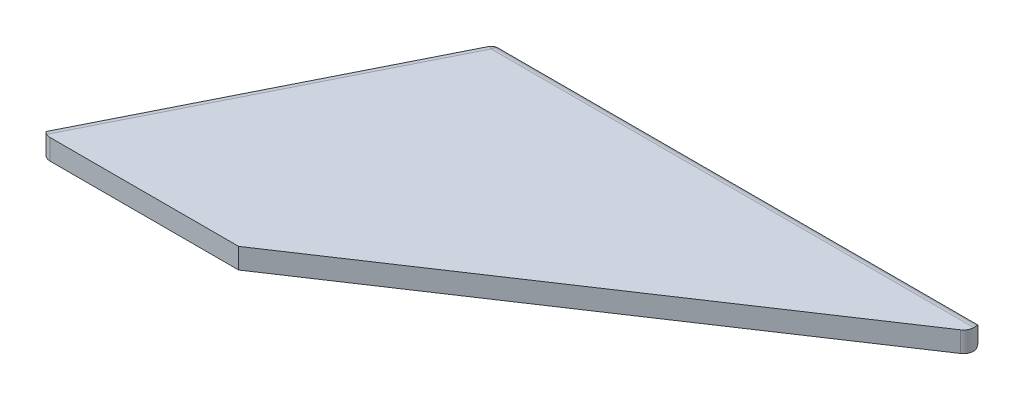
from build123d import *

# Parameters (mm, degrees)
BOSS_EXTRUDE1_DEPTH = 2
FILLET2_R           = 1


with BuildPart() as part:
    # Sketch1 → Boss-Extrude1 (new body)
    with BuildSketch(Plane(origin=(0, 0, 0), x_dir=(1, 0, 0), z_dir=(0, 1, 0))):
        Polygon((0, 0), (-20, 0), (-4.977119068, 30), (45.022880932, 30), align=None)
    extrude(amount=BOSS_EXTRUDE1_DEPTH)

    # Fillet2
    fillet2_edges = [part.edges().sort_by_distance(p)[0] for p in [
        (-12.488559534, 2, -15),
        (-12.488559534, 0, -15),
        (20.022880932, 0, -30),
        (-20, 1, 0),
        (-4.977119068, 1, -30),
        (45.022880932, 1, -30),
        (20.022880932, 2, -30),
    ]]
    fillet(fillet2_edges, radius=FILLET2_R - 0.0001)  # a hair under: the kernel refuses the full size


solid = part.part
